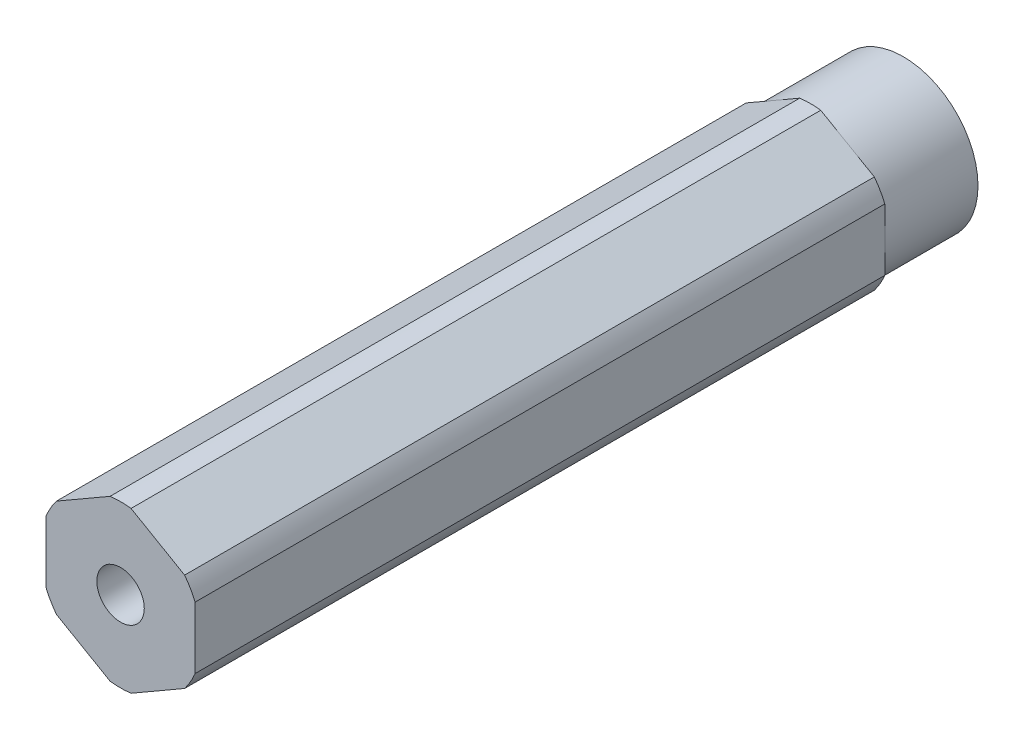
from build123d import *

# Parameters (mm, degrees)
BOSS_EXTRUDE1_DEPTH                  = 33.3375
SKETCH3_R                            = 2.0193
CUT_EXTRUDE1_DEPTH                   = 68.328625042
CUT_EXTRUDE3_START                   = -7.9375
SKETCH8_R                            = 6.875
SKETCH8_R_2                          = 6.35
CUT_EXTRUDE3_DEPTH                   = 7.9375
F_10_32_TAPPED_HOLE1_D               = 4.0386
F_10_32_TAPPED_HOLE1_DEPTH           = 12.02944
F_10_32_TAPPED_HOLE1_TIP             = 1.213317848
F_10_32_TAPPED_HOLE1_ON_FACE_2_D     = 4.0386
F_10_32_TAPPED_HOLE1_ON_FACE_2_DEPTH = 12.02944
F_10_32_TAPPED_HOLE1_ON_FACE_2_TIP   = 1.213317848


with BuildPart() as part:
    # Sketch1 → Boss-Extrude1 (new, symmetric)
    with BuildSketch(Plane.XY):
        with BuildLine():
            Line((-0.893039494, 6.816751826), (-5.456960506, 4.181770802))
            ThreePointArc((-5.456960506, 4.181770802), (-5.953924651, 3.4375), (-6.35, 2.634981025))
            Line((-6.35, 2.634981025), (-6.35, -2.634981025))
            ThreePointArc((-6.35, -2.634981025), (-5.953924651, -3.4375), (-5.456960506, -4.181770802))
            Line((-5.456960506, -4.181770802), (-0.893039494, -6.816751826))
            ThreePointArc((-0.893039494, -6.816751826), (0, -6.875), (0.893039494, -6.816751826))
            Line((0.893039494, -6.816751826), (5.456960506, -4.181770802))
            ThreePointArc((5.456960506, -4.181770802), (5.953924651, -3.4375), (6.35, -2.634981025))
            Line((6.35, -2.634981025), (6.35, 2.634981025))
            ThreePointArc((6.35, 2.634981025), (5.953924651, 3.4375), (5.456960506, 4.181770802))
            Line((5.456960506, 4.181770802), (0.893039494, 6.816751826))
            ThreePointArc((0.893039494, 6.816751826), (0, 6.875), (-0.893039494, 6.816751826))
        make_face()
    extrude(amount=BOSS_EXTRUDE1_DEPTH, both=True)

    # Sketch3 → Cut-Extrude1 (cut, through all)
    with BuildSketch(Plane.XY.offset(33.3375)):
        Circle(SKETCH3_R)
    extrude(amount=-CUT_EXTRUDE1_DEPTH, mode=Mode.SUBTRACT)

    # Sketch8 → Cut-Extrude3 (cut)
    with BuildSketch(Plane(origin=(0, 0, -33.3375), x_dir=(-1, 0, 0), z_dir=(0, 0, -1)).offset(CUT_EXTRUDE3_START)):
        Circle(SKETCH8_R)
        Circle(SKETCH8_R_2, mode=Mode.SUBTRACT)
    extrude(amount=CUT_EXTRUDE3_DEPTH, mode=Mode.SUBTRACT)

    # #10-32 Tapped Hole1
    with Locations(Plane(origin=(0, 0, -33.3375), x_dir=(-1, 0, 0), z_dir=(0, 0, -1))):
        with Locations((0, 0)):
            Hole(F_10_32_TAPPED_HOLE1_D / 2, depth=F_10_32_TAPPED_HOLE1_DEPTH)
            with Locations((0, 0, -(F_10_32_TAPPED_HOLE1_DEPTH + F_10_32_TAPPED_HOLE1_TIP / 2))):  # 118° drill point
                Cone(0, F_10_32_TAPPED_HOLE1_D / 2, F_10_32_TAPPED_HOLE1_TIP, mode=Mode.SUBTRACT)

    # #10-32 Tapped Hole1 on face 2
    with Locations(Plane(origin=(0, 0, 33.3375), x_dir=(-1, 0, 0), z_dir=(0, 0, -1))):
        with Locations((0, 0)):
            Hole(F_10_32_TAPPED_HOLE1_ON_FACE_2_D / 2, depth=F_10_32_TAPPED_HOLE1_ON_FACE_2_DEPTH)
            with Locations((0, 0, -(F_10_32_TAPPED_HOLE1_ON_FACE_2_DEPTH + F_10_32_TAPPED_HOLE1_ON_FACE_2_TIP / 2))):  # 118° drill point
                Cone(0, F_10_32_TAPPED_HOLE1_ON_FACE_2_D / 2, F_10_32_TAPPED_HOLE1_ON_FACE_2_TIP, mode=Mode.SUBTRACT)


solid = part.part
